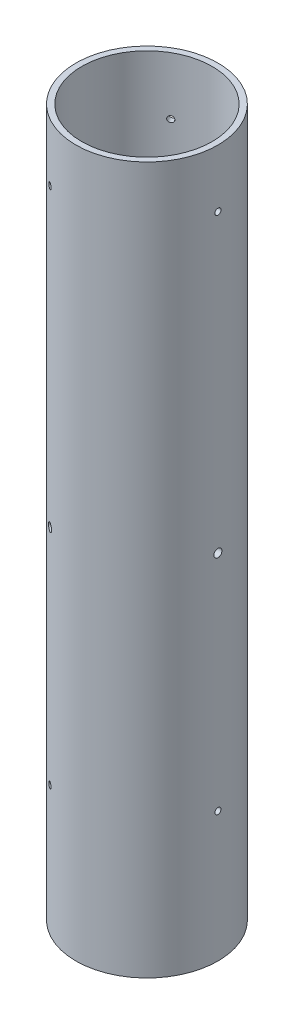
from build123d import *

# Parameters (mm, degrees)
SKETCH1_R                        = 41.656
SKETCH1_R_2                      = 38.227
BOSS_EXTRUDE1_DEPTH              = 414.3375
CUT_EXTRUDE1_REACH               = 428.171
SKETCH2_R                        = 1.778
CIRPATTERN1_COUNT                = 3
PRESSURE_EQUALIZATION_HOLE_REACH = 428.171
SKETCH3_R                        = 2.38125
CIRPATTERN2_COUNT                = 3
CUT_EXTRUDE3_REACH               = 426.678
SKETCH4_R                        = 1.7859375
CIRPATTERN3_COUNT                = 3


with BuildPart() as part:
    # Sketch1 → Boss-Extrude1 (new body)
    with BuildSketch(Plane(origin=(0, 0, 0), x_dir=(1, 0, 0), z_dir=(0, 1, 0))):
        Circle(SKETCH1_R)
        Circle(SKETCH1_R_2, mode=Mode.SUBTRACT)
    extrude(amount=BOSS_EXTRUDE1_DEPTH)

    # Sketch2 → Cut-Extrude1 (cut, up to next)
    with BuildSketch(Plane(origin=(-20.828, 0, 36.07515422), x_dir=(0, -1, 0), z_dir=(-0.499999999999998, 0, 0.8660254037844398)), mode=Mode.PRIVATE) as cut_extrude1_sk1:
        with Locations((-76.2, 0)):
            Circle(SKETCH2_R)
    cut_extrude1_tool1 = extrude(cut_extrude1_sk1.sketch, amount=-CUT_EXTRUDE1_REACH, mode=Mode.PRIVATE) & part.part
    cut_extrude1 = cut_extrude1_tool1.solids().sort_by_distance((-20.828, 76.2, 36.075154))[0]
    add(cut_extrude1, mode=Mode.SUBTRACT)

    # CirPattern1: Cut-Extrude1 ×3 about axis
    cirpattern1_axis = Axis((0, -7.62, 0), (0, 1, 0))
    for i in range(1, CIRPATTERN1_COUNT):
        add(cut_extrude1.rotate(cirpattern1_axis, i * 360 / CIRPATTERN1_COUNT), mode=Mode.SUBTRACT)

    # Sketch3 → Pressure Equalization Hole (cut, up to next)
    with BuildSketch(Plane(origin=(-20.828, 0, 36.07515422), x_dir=(0, -1, 0), z_dir=(-0.499999999999998, 0, 0.8660254037844398)), mode=Mode.PRIVATE) as pressure_equalization_hole_sk1:
        with Locations((-207.16875, 0)):
            Circle(SKETCH3_R)
    pressure_equalization_hole_tool1 = extrude(pressure_equalization_hole_sk1.sketch, amount=-PRESSURE_EQUALIZATION_HOLE_REACH, mode=Mode.PRIVATE) & part.part
    pressure_equalization_hole = pressure_equalization_hole_tool1.solids().sort_by_distance((-20.828, 207.16875, 36.075154))[0]
    add(pressure_equalization_hole, mode=Mode.SUBTRACT)

    # CirPattern2: Pressure Equalization Hole ×3 about axis
    cirpattern2_axis = Axis((0, -7.62, 0), (0, 1, 0))
    for i in range(1, CIRPATTERN2_COUNT):
        add(pressure_equalization_hole.rotate(cirpattern2_axis, i * 360 / CIRPATTERN2_COUNT), mode=Mode.SUBTRACT)

    # Sketch4 → Cut-Extrude3 (cut, up to next)
    with BuildSketch(Plane(origin=(41.656, 0, 0), x_dir=(0, -1, 0), z_dir=(-1, 0, 0)), mode=Mode.PRIVATE) as cut_extrude3_sk1:
        with Locations((-380.5301, 0)):
            Circle(SKETCH4_R)
    cut_extrude3_tool1 = extrude(cut_extrude3_sk1.sketch, amount=CUT_EXTRUDE3_REACH, mode=Mode.PRIVATE) & part.part
    cut_extrude3 = cut_extrude3_tool1.solids().sort_by_distance((41.656, 380.5301, 0))[0]
    add(cut_extrude3, mode=Mode.SUBTRACT)

    # CirPattern3: Cut-Extrude3 ×3 about axis
    cirpattern3_axis = Axis((0, -7.62, 0), (0, 1, 0))
    for i in range(1, CIRPATTERN3_COUNT):
        add(cut_extrude3.rotate(cirpattern3_axis, i * 360 / CIRPATTERN3_COUNT), mode=Mode.SUBTRACT)


solid = part.part
